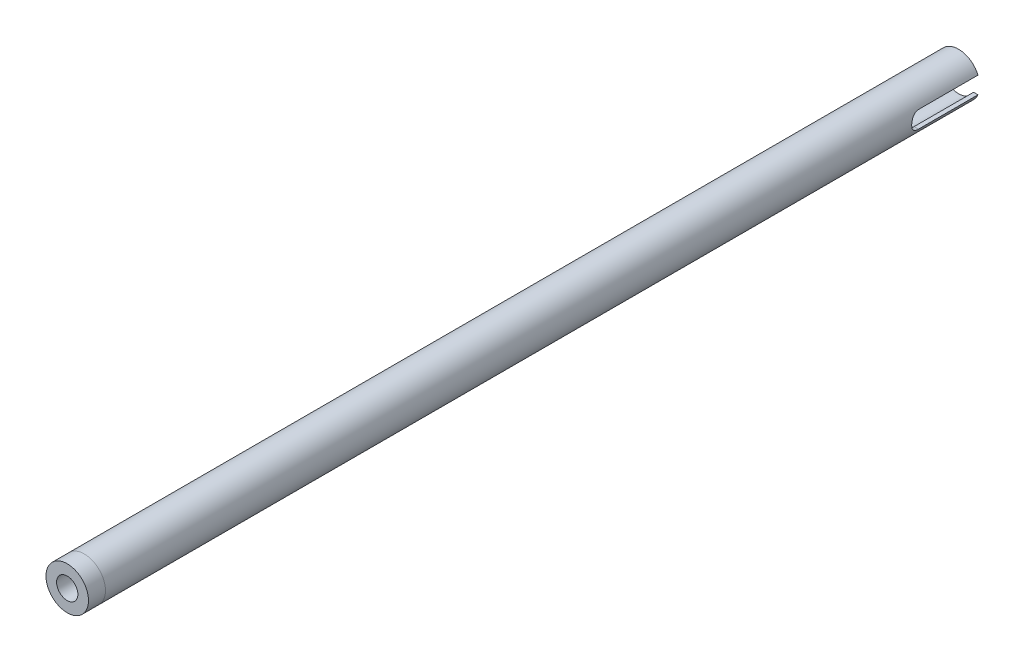
from build123d import *

# Parameters (mm, degrees)
THREADED_INSERT_1_1_DEPTH = 6.35
THREADED_START            = -6.35
THREADED_INSERT_1_2_DEPTH = 9.525
A_ARM_START               = -6.35
A_ARM_TUBE_DEPTH          = 326.311725
APEX_START                = -307.261725
APEX_SLOT_DEPTH           = 25.4
FILLET1_R                 = 3.175


with BuildPart() as part:
    # Sketch1 → Threaded insert 1-1 (new body)
    with BuildSketch(Plane.XY):
        with BuildLine():
            ThreePointArc((-2.38125, 3.175), (0, 3.96875), (2.38125, 3.175))
            Line((2.38125, 3.175), (5.630856905, 3.175))
            ThreePointArc((5.630856905, 3.175), (0, 6.4643), (-5.630856905, 3.175))
            Line((-5.630856905, 3.175), (-2.38125, 3.175))
        make_face()
        with BuildLine():
            ThreePointArc((-5.630856905, 3.175), (0, 6.4643), (5.630856905, 3.175))
            Line((5.630856905, 3.175), (7.274838916, 3.175))
            ThreePointArc((7.274838916, 3.175), (0, 7.9375), (-7.274838916, 3.175))
            Line((-7.274838916, 3.175), (-5.630856905, 3.175))
        make_face()
        with BuildLine():
            ThreePointArc((2.38125, 3.175), (3.549757914, 1.774878957), (3.96875, 0))
            Line((3.96875, 0), (6.4643, 0))
            ThreePointArc((6.4643, 0), (6.252468424, 1.641283978), (5.630856905, 3.175))
            Line((5.630856905, 3.175), (2.38125, 3.175))
        make_face()
        with BuildLine():
            Line((-6.4643, 0), (-3.96875, 0))
            ThreePointArc((-3.96875, 0), (-3.549757914, 1.774878957), (-2.38125, 3.175))
            Line((-2.38125, 3.175), (-5.630856905, 3.175))
            ThreePointArc((-5.630856905, 3.175), (-6.252468424, 1.641283978), (-6.4643, 0))
        make_face()
        with BuildLine():
            ThreePointArc((5.630856905, 3.175), (6.252468424, 1.641283978), (6.4643, 0))
            Line((6.4643, 0), (7.9375, 0))
            ThreePointArc((7.9375, 0), (7.770068859, 1.621707797), (7.274838916, 3.175))
            Line((7.274838916, 3.175), (5.630856905, 3.175))
        make_face()
        with BuildLine():
            Line((-7.9375, 0), (-6.4643, 0))
            ThreePointArc((-6.4643, 0), (-6.252468424, 1.641283978), (-5.630856905, 3.175))
            Line((-5.630856905, 3.175), (-7.274838916, 3.175))
            ThreePointArc((-7.274838916, 3.175), (-7.770068859, 1.621707797), (-7.9375, 0))
        make_face()
        with BuildLine():
            Line((7.9375, 0), (6.4643, 0))
            ThreePointArc((6.4643, 0), (6.252468424, -1.641283978), (5.630856905, -3.175))
            Line((5.630856905, -3.175), (7.274838916, -3.175))
            ThreePointArc((7.274838916, -3.175), (7.770068859, -1.621707797), (7.9375, 0))
        make_face()
        with BuildLine():
            ThreePointArc((-5.630856905, -3.175), (-6.252468424, -1.641283978), (-6.4643, 0))
            Line((-6.4643, 0), (-7.9375, 0))
            ThreePointArc((-7.9375, 0), (-7.770068859, -1.621707797), (-7.274838916, -3.175))
            Line((-7.274838916, -3.175), (-5.630856905, -3.175))
        make_face()
        with BuildLine():
            Line((6.4643, 0), (3.96875, 0))
            ThreePointArc((3.96875, 0), (3.549757914, -1.774878957), (2.38125, -3.175))
            Line((2.38125, -3.175), (5.630856905, -3.175))
            ThreePointArc((5.630856905, -3.175), (6.252468424, -1.641283978), (6.4643, 0))
        make_face()
        with BuildLine():
            ThreePointArc((-2.38125, -3.175), (-3.549757914, -1.774878957), (-3.96875, 0))
            Line((-3.96875, 0), (-6.4643, 0))
            ThreePointArc((-6.4643, 0), (-6.252468424, -1.641283978), (-5.630856905, -3.175))
            Line((-5.630856905, -3.175), (-2.38125, -3.175))
        make_face()
        with BuildLine():
            Line((5.630856905, -3.175), (2.38125, -3.175))
            ThreePointArc((2.38125, -3.175), (0, -3.96875), (-2.38125, -3.175))
            Line((-2.38125, -3.175), (-5.630856905, -3.175))
            ThreePointArc((-5.630856905, -3.175), (0, -6.4643), (5.630856905, -3.175))
        make_face()
        with BuildLine():
            Line((7.274838916, -3.175), (5.630856905, -3.175))
            ThreePointArc((5.630856905, -3.175), (0, -6.4643), (-5.630856905, -3.175))
            Line((-5.630856905, -3.175), (-7.274838916, -3.175))
            ThreePointArc((-7.274838916, -3.175), (0, -7.9375), (7.274838916, -3.175))
        make_face()
    extrude(amount=-THREADED_INSERT_1_1_DEPTH)

    # Sketch1<3> → Threaded insert 1-2 (add)
    with BuildSketch(Plane.XY.offset(THREADED_START)):
        with BuildLine():
            ThreePointArc((-2.38125, 3.175), (0, 3.96875), (2.38125, 3.175))
            Line((2.38125, 3.175), (5.630856905, 3.175))
            ThreePointArc((5.630856905, 3.175), (0, 6.4643), (-5.630856905, 3.175))
            Line((-5.630856905, 3.175), (-2.38125, 3.175))
        make_face()
        with BuildLine():
            ThreePointArc((2.38125, 3.175), (3.549757914, 1.774878957), (3.96875, 0))
            Line((3.96875, 0), (6.4643, 0))
            ThreePointArc((6.4643, 0), (6.252468424, 1.641283978), (5.630856905, 3.175))
            Line((5.630856905, 3.175), (2.38125, 3.175))
        make_face()
        with BuildLine():
            Line((-6.4643, 0), (-3.96875, 0))
            ThreePointArc((-3.96875, 0), (-3.549757914, 1.774878957), (-2.38125, 3.175))
            Line((-2.38125, 3.175), (-5.630856905, 3.175))
            ThreePointArc((-5.630856905, 3.175), (-6.252468424, 1.641283978), (-6.4643, 0))
        make_face()
        with BuildLine():
            Line((6.4643, 0), (3.96875, 0))
            ThreePointArc((3.96875, 0), (3.549757914, -1.774878957), (2.38125, -3.175))
            Line((2.38125, -3.175), (5.630856905, -3.175))
            ThreePointArc((5.630856905, -3.175), (6.252468424, -1.641283978), (6.4643, 0))
        make_face()
        with BuildLine():
            ThreePointArc((-2.38125, -3.175), (-3.549757914, -1.774878957), (-3.96875, 0))
            Line((-3.96875, 0), (-6.4643, 0))
            ThreePointArc((-6.4643, 0), (-6.252468424, -1.641283978), (-5.630856905, -3.175))
            Line((-5.630856905, -3.175), (-2.38125, -3.175))
        make_face()
        with BuildLine():
            Line((5.630856905, -3.175), (2.38125, -3.175))
            ThreePointArc((2.38125, -3.175), (0, -3.96875), (-2.38125, -3.175))
            Line((-2.38125, -3.175), (-5.630856905, -3.175))
            ThreePointArc((-5.630856905, -3.175), (0, -6.4643), (5.630856905, -3.175))
        make_face()
    extrude(amount=-THREADED_INSERT_1_2_DEPTH)


with BuildPart() as body_2:
    # Sketch1<4> → A-arm tube (new body)
    with BuildSketch(Plane.XY.offset(A_ARM_START)):
        with BuildLine():
            ThreePointArc((-5.630856905, 3.175), (0, 6.4643), (5.630856905, 3.175))
            Line((5.630856905, 3.175), (7.274838916, 3.175))
            ThreePointArc((7.274838916, 3.175), (0, 7.9375), (-7.274838916, 3.175))
            Line((-7.274838916, 3.175), (-5.630856905, 3.175))
        make_face()
        with BuildLine():
            ThreePointArc((5.630856905, 3.175), (6.252468424, 1.641283978), (6.4643, 0))
            Line((6.4643, 0), (7.9375, 0))
            ThreePointArc((7.9375, 0), (7.770068859, 1.621707797), (7.274838916, 3.175))
            Line((7.274838916, 3.175), (5.630856905, 3.175))
        make_face()
        with BuildLine():
            Line((-7.9375, 0), (-6.4643, 0))
            ThreePointArc((-6.4643, 0), (-6.252468424, 1.641283978), (-5.630856905, 3.175))
            Line((-5.630856905, 3.175), (-7.274838916, 3.175))
            ThreePointArc((-7.274838916, 3.175), (-7.770068859, 1.621707797), (-7.9375, 0))
        make_face()
        with BuildLine():
            Line((7.9375, 0), (6.4643, 0))
            ThreePointArc((6.4643, 0), (6.252468424, -1.641283978), (5.630856905, -3.175))
            Line((5.630856905, -3.175), (7.274838916, -3.175))
            ThreePointArc((7.274838916, -3.175), (7.770068859, -1.621707797), (7.9375, 0))
        make_face()
        with BuildLine():
            ThreePointArc((-5.630856905, -3.175), (-6.252468424, -1.641283978), (-6.4643, 0))
            Line((-6.4643, 0), (-7.9375, 0))
            ThreePointArc((-7.9375, 0), (-7.770068859, -1.621707797), (-7.274838916, -3.175))
            Line((-7.274838916, -3.175), (-5.630856905, -3.175))
        make_face()
        with BuildLine():
            Line((7.274838916, -3.175), (5.630856905, -3.175))
            ThreePointArc((5.630856905, -3.175), (0, -6.4643), (-5.630856905, -3.175))
            Line((-5.630856905, -3.175), (-7.274838916, -3.175))
            ThreePointArc((-7.274838916, -3.175), (0, -7.9375), (7.274838916, -3.175))
        make_face()
    extrude(amount=-A_ARM_TUBE_DEPTH)

    # Sketch1<5> → Apex slot (cut)
    with BuildSketch(Plane.XY.offset(APEX_START)):
        with BuildLine():
            ThreePointArc((5.630856905, 3.175), (6.252468424, 1.641283978), (6.4643, 0))
            Line((6.4643, 0), (7.9375, 0))
            ThreePointArc((7.9375, 0), (7.770068859, 1.621707797), (7.274838916, 3.175))
            Line((7.274838916, 3.175), (5.630856905, 3.175))
        make_face()
        with BuildLine():
            Line((-7.9375, 0), (-6.4643, 0))
            ThreePointArc((-6.4643, 0), (-6.252468424, 1.641283978), (-5.630856905, 3.175))
            Line((-5.630856905, 3.175), (-7.274838916, 3.175))
            ThreePointArc((-7.274838916, 3.175), (-7.770068859, 1.621707797), (-7.9375, 0))
        make_face()
        with BuildLine():
            Line((7.9375, 0), (6.4643, 0))
            ThreePointArc((6.4643, 0), (6.252468424, -1.641283978), (5.630856905, -3.175))
            Line((5.630856905, -3.175), (7.274838916, -3.175))
            ThreePointArc((7.274838916, -3.175), (7.770068859, -1.621707797), (7.9375, 0))
        make_face()
        with BuildLine():
            ThreePointArc((-5.630856905, -3.175), (-6.252468424, -1.641283978), (-6.4643, 0))
            Line((-6.4643, 0), (-7.9375, 0))
            ThreePointArc((-7.9375, 0), (-7.770068859, -1.621707797), (-7.274838916, -3.175))
            Line((-7.274838916, -3.175), (-5.630856905, -3.175))
        make_face()
    extrude(amount=-APEX_SLOT_DEPTH, mode=Mode.SUBTRACT)

    # Fillet1
    # the kernel refuses this fillet: 3.175 mm, written as the material it adds along each edge
    with BuildSketch(Plane(origin=(2.306643095, 3.175, -307.261725), x_dir=(0, 0, -1), z_dir=(-1, 0, 0))) as fillet1_piece_1_section:
        with BuildLine():
            CenterArc((FILLET1_R, FILLET1_R), FILLET1_R, 180, 90)
            Line((0, FILLET1_R), (0, 0))
            Line((0, 0), (FILLET1_R, 0))
        make_face()
    fillet1_piece_1 = extrude(amount=17.51898201, mode=Mode.PRIVATE)
    fillet1_piece_1 = fillet1_piece_1 - Plane(origin=(0, 0, -307.98145762), x_dir=(-0.8710698614669244, 0.49115913555994567, 0), z_dir=(0, 0, 1)) * Cylinder(6.4643, 48, mode=Mode.PRIVATE)
    fillet1_piece_1 = fillet1_piece_1 & Plane(origin=(0, 0, -307.98145762), x_dir=(-1, 0, 0), z_dir=(0, 0, 1)) * Cylinder(7.9375, 48, mode=Mode.PRIVATE)
    add(fillet1_piece_1)
    with BuildSketch(Plane(origin=(-15.212338916, -3.175, -307.261725), x_dir=(0, 0, -1), z_dir=(1, 0, 0))) as fillet1_piece_2_section:
        with BuildLine():
            CenterArc((FILLET1_R, FILLET1_R), FILLET1_R, 180, 90)
            Line((0, FILLET1_R), (0, 0))
            Line((0, 0), (FILLET1_R, 0))
        make_face()
    fillet1_piece_2 = extrude(amount=17.51898201, mode=Mode.PRIVATE)
    fillet1_piece_2 = fillet1_piece_2 - Plane(origin=(0, 0, -307.981457783), x_dir=(-0.8710698614669244, 0.49115913555994567, 0), z_dir=(0, 0, 1)) * Cylinder(6.4643, 48, mode=Mode.PRIVATE)
    fillet1_piece_2 = fillet1_piece_2 & Plane(origin=(0, 0, -307.981457783), x_dir=(-1, 0, 0), z_dir=(0, 0, 1)) * Cylinder(7.9375, 48, mode=Mode.PRIVATE)
    add(fillet1_piece_2)
    with BuildSketch(Plane(origin=(-2.306643095, -3.175, -307.261725), x_dir=(0, 0, -1), z_dir=(1, 0, 0))) as fillet1_piece_3_section:
        with BuildLine():
            CenterArc((FILLET1_R, FILLET1_R), FILLET1_R, 180, 90)
            Line((0, FILLET1_R), (0, 0))
            Line((0, 0), (FILLET1_R, 0))
        make_face()
    fillet1_piece_3 = extrude(amount=17.51898201, mode=Mode.PRIVATE)
    fillet1_piece_3 = fillet1_piece_3 - Plane(origin=(0, 0, -307.98145762), x_dir=(-0.8710698614669244, 0.49115913555994567, 0), z_dir=(0, 0, 1)) * Cylinder(6.4643, 48, mode=Mode.PRIVATE)
    fillet1_piece_3 = fillet1_piece_3 & Plane(origin=(0, 0, -307.98145762), x_dir=(-1, 0, 0), z_dir=(0, 0, 1)) * Cylinder(7.9375, 48, mode=Mode.PRIVATE)
    add(fillet1_piece_3)
    with BuildSketch(Plane(origin=(15.212338916, 3.175, -307.261725), x_dir=(0, -1, 0), z_dir=(-1, 0, 0))) as fillet1_piece_4_section:
        with BuildLine():
            CenterArc((FILLET1_R, -FILLET1_R), FILLET1_R, 90, 90)
            Line((0, -FILLET1_R), (0, 0))
            Line((0, 0), (FILLET1_R, 0))
        make_face()
    fillet1_piece_4 = extrude(amount=17.51898201, mode=Mode.PRIVATE)
    fillet1_piece_4 = fillet1_piece_4 - Plane(origin=(0, 0, -307.981457609), x_dir=(-0.8710698614669244, 0.49115913555994567, 0), z_dir=(0, 0, 1)) * Cylinder(6.4643, 48, mode=Mode.PRIVATE)
    fillet1_piece_4 = fillet1_piece_4 & Plane(origin=(0, 0, -307.981457609), x_dir=(-1, 0, 0), z_dir=(0, 0, 1)) * Cylinder(7.9375, 48, mode=Mode.PRIVATE)
    add(fillet1_piece_4)


solid = Compound([part.part, body_2.part])
